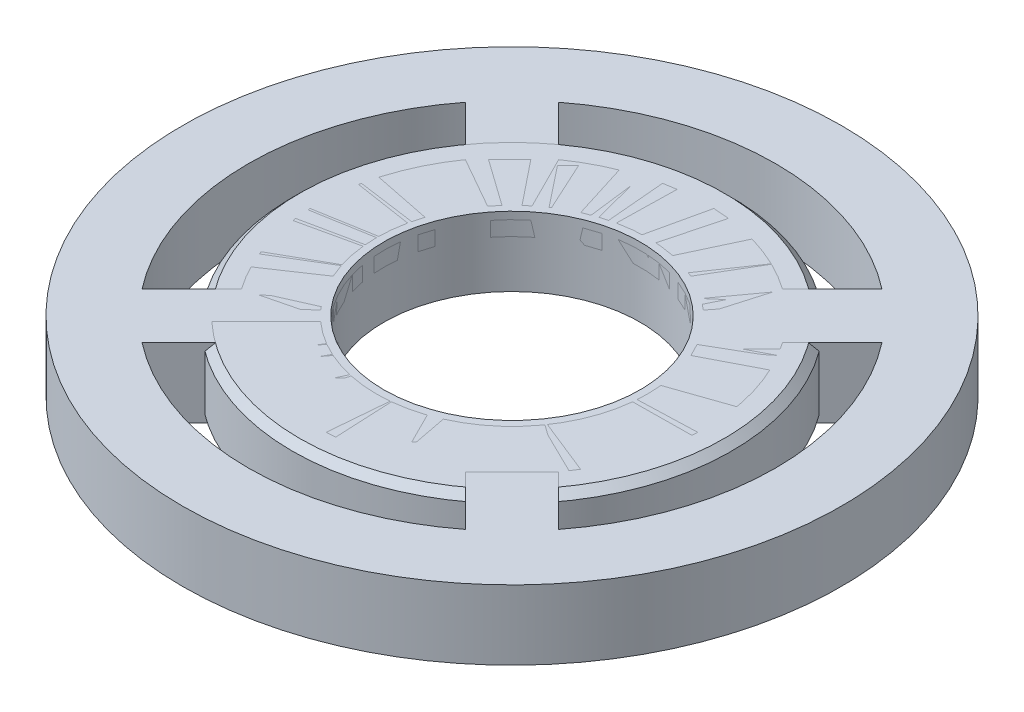
from build123d import *

# Parameters (mm, degrees)
SKETCH2_R           = 45
SKETCH2_R_2         = 36
SKETCH2_R_3         = 26.5
SKETCH2_R_4         = 17.5
BOSS_EXTRUDE2_DEPTH = 9.5
SKETCH4_R           = 30
SKETCH4_R_2         = 17.5
BOSS_EXTRUDE3_DEPTH = 3
SKETCH5_R           = 30
SKETCH5_R_2         = 25
BOSS_EXTRUDE4_DEPTH = 3.5
SKETCH7_R           = 30
SKETCH7_R_2         = 17.5
BOSS_EXTRUDE5_DEPTH = 3
CHAMFER1_SIZE       = 1
CHAMFER2_SIZE       = 1
CHAMFER3_SIZE       = 1
CHAMFER4_SIZE       = 1


with BuildPart() as part:
    # Sketch2 → Boss-Extrude2 (new body)
    # profile 1 of 6: a face of its own
    with BuildSketch(Plane(origin=(0, 0, 0), x_dir=(1, 0, 0), z_dir=(0, 1, 0))):
        with Locations(Location((0, 0, 0), (0, 0, 270))):
            Circle(SKETCH2_R)
        Circle(SKETCH2_R_2, mode=Mode.SUBTRACT)
    # profile 2 of 6: a face of its own
    with BuildSketch(Plane(origin=(0, 0, 0), x_dir=(1, 0, 0), z_dir=(0, 1, 0))):
        with BuildLine():
            Line((22.074206845, 28.438167876), (15.284204797, 21.648165828))
            ThreePointArc((15.284204797, 21.648165828), (18.738329701, 18.738329701), (21.648165828, 15.284204797))
            Line((21.648165828, 15.284204797), (28.438167876, 22.074206845))
            ThreePointArc((28.438167876, 22.074206845), (25.455844123, 25.455844123), (22.074206845, 28.438167876))
        make_face()
    # profile 3 of 6: a face of its own
    with BuildSketch(Plane(origin=(0, 0, 0), x_dir=(1, 0, 0), z_dir=(0, 1, 0))):
        with BuildLine():
            Line((28.438167876, -22.074206845), (21.648165828, -15.284204797))
            ThreePointArc((21.648165828, -15.284204797), (18.738329701, -18.738329701), (15.284204797, -21.648165828))
            Line((15.284204797, -21.648165828), (22.074206845, -28.438167876))
            ThreePointArc((22.074206845, -28.438167876), (25.455844123, -25.455844123), (28.438167876, -22.074206845))
        make_face()
    # profile 4 of 6: a face of its own
    with BuildSketch(Plane(origin=(0, 0, 0), x_dir=(1, 0, 0), z_dir=(0, 1, 0))):
        with BuildLine():
            ThreePointArc((-15.284204797, -21.648165828), (-18.738329701, -18.738329701), (-21.648165828, -15.284204797))
            Line((-21.648165828, -15.284204797), (-28.438167876, -22.074206845))
            ThreePointArc((-28.438167876, -22.074206845), (-25.455844123, -25.455844123), (-22.074206845, -28.438167876))
            Line((-22.074206845, -28.438167876), (-15.284204797, -21.648165828))
        make_face()
    # profile 5 of 6: a face of its own
    with BuildSketch(Plane(origin=(0, 0, 0), x_dir=(1, 0, 0), z_dir=(0, 1, 0))):
        with BuildLine():
            ThreePointArc((-21.648165828, 15.284204797), (-18.738329701, 18.738329701), (-15.284204797, 21.648165828))
            Line((-15.284204797, 21.648165828), (-22.074206845, 28.438167876))
            ThreePointArc((-22.074206845, 28.438167876), (-25.455844123, 25.455844123), (-28.438167876, 22.074206845))
            Line((-28.438167876, 22.074206845), (-21.648165828, 15.284204797))
        make_face()
    # profile 6 of 6: a face of its own
    with BuildSketch(Plane(origin=(0, 0, 0), x_dir=(1, 0, 0), z_dir=(0, 1, 0))):
        Circle(SKETCH2_R_3)
        with Locations(Location((0, 0, 0), (0, 0, 270))):
            Circle(SKETCH2_R_4, mode=Mode.SUBTRACT)
    extrude(amount=BOSS_EXTRUDE2_DEPTH)


with BuildPart() as body_2:
    # Sketch4 → Boss-Extrude3 (new body)
    with BuildSketch(Plane(origin=(0, 0, 0), x_dir=(1, 0, 0), z_dir=(0, 1, 0))):
        with Locations(Location((0, 0, 0), (0, 0, 270))):
            Circle(SKETCH4_R)
        with Locations(Location((0, 0, 0), (0, 0, 270))):
            Circle(SKETCH4_R_2, mode=Mode.SUBTRACT)
    extrude(amount=BOSS_EXTRUDE3_DEPTH)

    # Sketch5 → Boss-Extrude4 (add)
    with BuildSketch(Plane(origin=(0, 3, 0), x_dir=(1, 0, 0), z_dir=(0, 1, 0))):
        with Locations(Location((0, 0, 0), (0, 0, 270))):
            Circle(SKETCH5_R)
        with Locations(Location((0, 0, 0), (0, 0, 270))):
            Circle(SKETCH5_R_2, mode=Mode.SUBTRACT)
    extrude(amount=BOSS_EXTRUDE4_DEPTH)

    # Sketch7 → Boss-Extrude5 (add)
    with BuildSketch(Plane(origin=(0, 6.5, 0), x_dir=(1, 0, 0), z_dir=(0, 1, 0))):
        with Locations(Location((0, 0, 0), (0, 0, 270))):
            Circle(SKETCH7_R)
        with Locations(Location((0, 0, 0), (0, 0, 270))):
            Circle(SKETCH7_R_2, mode=Mode.SUBTRACT)
    extrude(amount=BOSS_EXTRUDE5_DEPTH)

    # Chamfer1
    chamfer1_edges = [body_2.edges().sort_by_distance(p)[0] for p in [
        (0, 9.5, -30),
    ]]
    chamfer(chamfer1_edges, length=CHAMFER1_SIZE)

    # Chamfer2
    chamfer2_edges = [body_2.edges().sort_by_distance(p)[0] for p in [
        (0, 0, -30),
    ]]
    chamfer(chamfer2_edges, length=CHAMFER2_SIZE)

    # Chamfer3
    chamfer3_edges = [body_2.edges().sort_by_distance(p)[0] for p in [
        (0, 0, -17.5),
    ]]
    chamfer(chamfer3_edges, length=CHAMFER3_SIZE)

    # Chamfer4
    chamfer4_edges = [body_2.edges().sort_by_distance(p)[0] for p in [
        (0, 9.5, -17.5),
    ]]
    chamfer(chamfer4_edges, length=CHAMFER4_SIZE)


solid = Compound([part.part, body_2.part])
